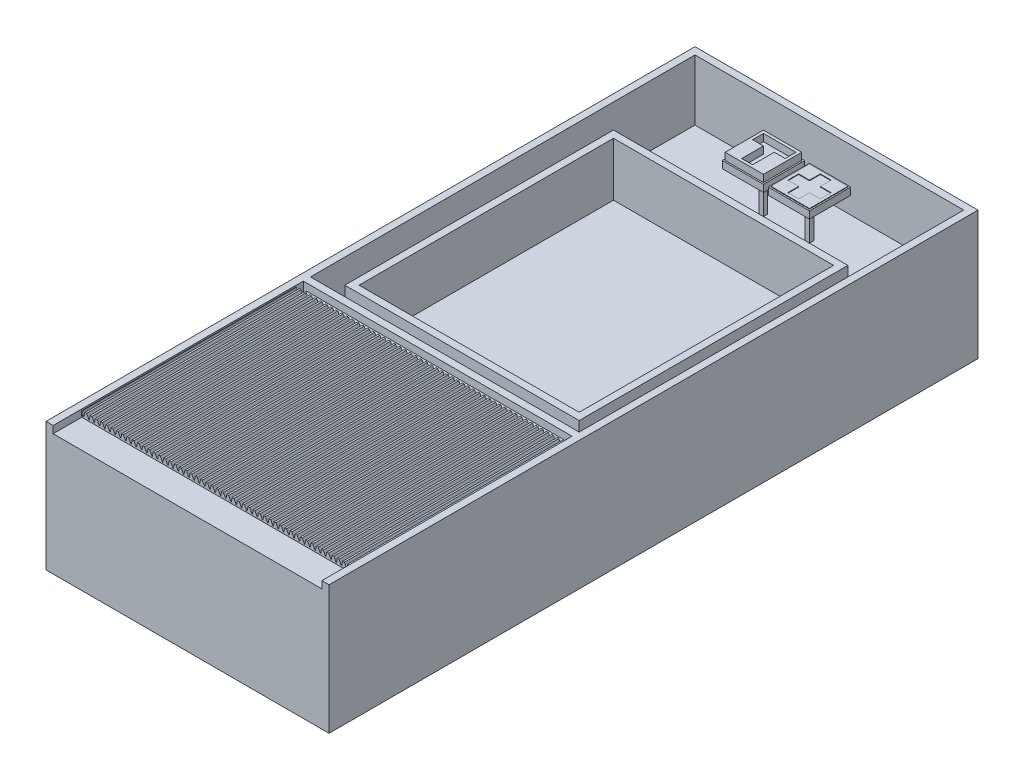
from build123d import *

# Parameters (mm, degrees)
SKETCH1_W              = 940
SKETCH1_H              = 2145
BOSS_EXTRUDE1_DEPTH    = 25
BOSS_EXTRUDE2_DEPTH    = 450
BOSS_EXTRUDE3_DEPTH    = 425
BOSS_EXTRUDE4_START    = 25
BOSS_EXTRUDE4_DEPTH    = 400
SKETCH2_W              = 1345
SKETCH2_H              = 25
BOSS_EXTRUDE5_DEPTH    = 965
STONE_START            = -25
STONE_ON_COUNTER_DEPTH = 940
SKETCH3_W              = 820
SKETCH3_H              = 940
SKETCH3_W_2            = 770
SKETCH3_H_2            = 890
BOSS_EXTRUDE7_DEPTH    = 187.5
BOSS_EXTRUDE11_START   = 25
SKETCH4_W              = 10
SKETCH4_H              = 20
BOSS_EXTRUDE11_DEPTH   = 750
BOSS_EXTRUDE12_START   = 25
BOSS_EXTRUDE12_DEPTH   = 750
LPATTERN2_COUNT        = 50
LPATTERN2_PITCH        = 18.4
SKETCH5_W              = 15
SKETCH5_H              = 15
BOSS_EXTRUDE13_DEPTH   = 137.5
BOSS_EXTRUDE14_START   = 137.5
SKETCH5_3_W            = 144
SKETCH5_3_H            = 144
BOSS_EXTRUDE14_DEPTH   = 25
BOSS_EXTRUDE14_2_DEPTH = 25
BOSS_EXTRUDE15_START   = 162.5
SKETCH5_4_W            = 134
SKETCH5_4_H            = 134
BOSS_EXTRUDE15_DEPTH   = 2
BOSS_EXTRUDE17_START   = 162.5
SKETCH5_5_W            = 134
SKETCH5_5_H            = 134
BOSS_EXTRUDE17_DEPTH   = 25


with BuildPart() as part:
    # Sketch1 → Boss-Extrude1 (new body)
    with BuildSketch(Plane(origin=(0, 0, 0), x_dir=(1, 0, 0), z_dir=(0, 1, 0))):
        with Locations((0, 37.5)):
            Rectangle(SKETCH1_W, SKETCH1_H)
    extrude(amount=BOSS_EXTRUDE1_DEPTH)

    # Sketch1<3> → Boss-Extrude2 (add)
    with BuildSketch(Plane(origin=(0, 0, 0), x_dir=(1, 0, 0), z_dir=(0, 1, 0))):
        Polygon((-470, -1135), (-470, -1035), (-470, -285), (-470, 1110), (470, 1110), (470, -285), (470, -1035), (470, -1135), (495, -1135), (495, 1135), (-495, 1135), (-495, -1135), align=None)
    extrude(amount=BOSS_EXTRUDE2_DEPTH)

    # Sketch1<4> → Boss-Extrude3 (add)
    with BuildSketch(Plane(origin=(0, 0, 0), x_dir=(1, 0, 0), z_dir=(0, 1, 0))):
        Polygon((-457.5, -1035), (-470, -1035), (-470, -1135), (470, -1135), (470, -1035), (457.5, -1035), align=None)
    extrude(amount=BOSS_EXTRUDE3_DEPTH)

    # Sketch1<5> → Boss-Extrude4 (add)
    with BuildSketch(Plane(origin=(0, 0, 0), x_dir=(1, 0, 0), z_dir=(0, 1, 0)).offset(BOSS_EXTRUDE4_START)):
        Polygon((-470, -285), (-470, -1035), (470, -1035), (470, -285), (457.5, -285), (457.5, -260), (-457.5, -260), (-457.5, -285), align=None)
    extrude(amount=BOSS_EXTRUDE4_DEPTH)

    # Sketch2 → Boss-Extrude5 (add)
    with BuildSketch(Plane.ZY.offset(495)):
        with Locations((-437.5, 225)):
            Rectangle(SKETCH2_W, SKETCH2_H)
    extrude(amount=-BOSS_EXTRUDE5_DEPTH)

    # Sketch2<3> → Stone On Counter (add)
    with BuildSketch(Plane.ZY.offset(495).offset(STONE_START)):
        Polygon((235, 450), (235, 237.5), (235, 212.5), (235, 25), (260, 25), (260, 425), (260, 450), align=None)
    extrude(amount=-STONE_ON_COUNTER_DEPTH)

    # Sketch3 → Boss-Extrude7 (add)
    with BuildSketch(Plane(origin=(0, 237.5, 0), x_dir=(1, 0, 0), z_dir=(0, 1, 0))):
        with Locations((0, 295)):
            Rectangle(SKETCH3_W, SKETCH3_H)
        with Locations((0, 295)):
            Rectangle(SKETCH3_W_2, SKETCH3_H_2, mode=Mode.SUBTRACT)
    extrude(amount=BOSS_EXTRUDE7_DEPTH)

    # Sketch4 → Boss-Extrude11 (add)
    with BuildSketch(Plane.XY.offset(260).offset(BOSS_EXTRUDE11_START)):
        Polygon((-470, 445), (-470, 425), (-468.312857577, 425), (-468.312857577, 430), (-468.312857577, 445), align=None)
        with Locations((465, 435)):
            Rectangle(SKETCH4_W, SKETCH4_H)
    extrude(amount=BOSS_EXTRUDE11_DEPTH)

    # Sketch4<4> → Boss-Extrude12 (add)
    with BuildSketch(Plane.XY.offset(260).offset(BOSS_EXTRUDE12_START)):
        Polygon((-468.312857577, 430), (-468.312857577, 425), (-444.987175715, 425), (-444.987175715, 430), (-452.979524244, 445), (-459.112857577, 445), (-462.179524244, 430), align=None)
    boss_extrude12 = extrude(amount=BOSS_EXTRUDE12_DEPTH)

    # LPattern2: Boss-Extrude12 ×50
    with Locations(*[(i * LPATTERN2_PITCH, 0, 0) for i in range(1, LPATTERN2_COUNT)]):
        add(boss_extrude12)

    # Sketch5 → Boss-Extrude13 (add)
    with BuildSketch(Plane(origin=(0, 237.5, 0), x_dir=(1, 0, 0), z_dir=(0, 1, 0))):
        with Locations((-80.5, 960)):
            Rectangle(SKETCH5_W, SKETCH5_H)
        with Locations((80.5, 960)):
            Rectangle(SKETCH5_W, SKETCH5_H)
    extrude(amount=BOSS_EXTRUDE13_DEPTH)



with BuildPart() as body_2:
    # Sketch5<3> → Boss-Extrude14 (new body)
    with BuildSketch(Plane(origin=(0, 237.5, 0), x_dir=(1, 0, 0), z_dir=(0, 1, 0)).offset(BOSS_EXTRUDE14_START)):
        with Locations((-80.5, 960)):
            Rectangle(SKETCH5_3_W, SKETCH5_3_H)
    extrude(amount=BOSS_EXTRUDE14_DEPTH)


with BuildPart() as body_3:
    # Sketch5<3> → Boss-Extrude14 2 (new body)
    with BuildSketch(Plane(origin=(0, 237.5, 0), x_dir=(1, 0, 0), z_dir=(0, 1, 0)).offset(BOSS_EXTRUDE14_START)):
        with Locations((80.5, 960)):
            Rectangle(SKETCH5_3_W, SKETCH5_3_H)
    extrude(amount=BOSS_EXTRUDE14_2_DEPTH)


with BuildPart() as part_1:
    add(part.part)

    add(body_3.part)  # Boss-Extrude15 merges body 3
    # Sketch5<4> → Boss-Extrude15 (add)
    with BuildSketch(Plane(origin=(0, 237.5, 0), x_dir=(1, 0, 0), z_dir=(0, 1, 0)).offset(BOSS_EXTRUDE15_START)):
        with Locations((80.5, 960)):
            Rectangle(SKETCH5_4_W, SKETCH5_4_H)
        Polygon((99.5, 903), (61.5, 903), (61.5, 941), (23.5, 941), (23.5, 979), (61.5, 979), (61.5, 1017), (99.5, 1017), (99.5, 979), (137.5, 979), (137.5, 941), (99.5, 941), align=None, mode=Mode.SUBTRACT)
    extrude(amount=BOSS_EXTRUDE15_DEPTH)


with BuildPart() as body_3_2:
    # Sketch5<5> → Boss-Extrude17 (new body)
    with BuildSketch(Plane(origin=(0, 237.5, 0), x_dir=(1, 0, 0), z_dir=(0, 1, 0)).offset(BOSS_EXTRUDE17_START)):
        with Locations((-80.5, 960)):
            Rectangle(SKETCH5_5_W, SKETCH5_5_H)
        Polygon((-99.5, 979), (-137.5, 979), (-137.5, 1017), (-23.5, 1017), (-23.5, 979), (-61.5, 979), (-61.5, 903), (-99.5, 903), align=None, mode=Mode.SUBTRACT)
    extrude(amount=BOSS_EXTRUDE17_DEPTH)


solid = Compound([body_2.part, part_1.part, body_3_2.part])
